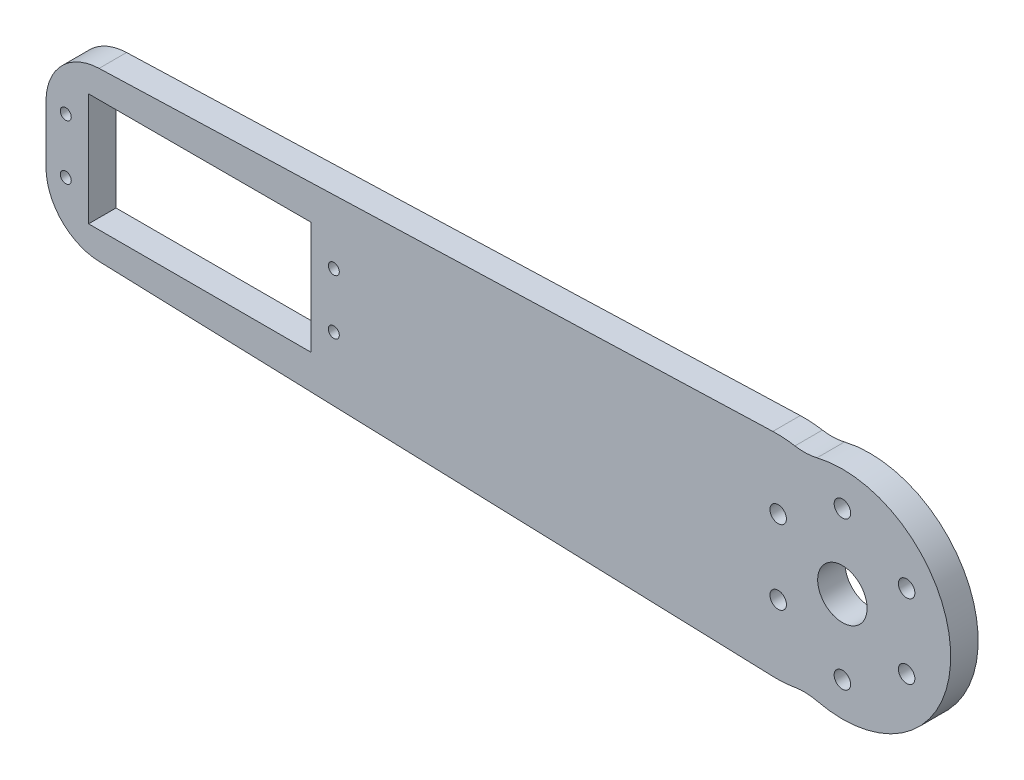
from build123d import *

# Parameters (mm, degrees)
SKETCH1_R           = 3
SKETCH1_W           = 40.5
SKETCH1_H           = 20.5
BOSS_EXTRUDE1_DEPTH = 5
FILLET2_R           = 20
BOSS_EXTRUDE2_START = -5
SKETCH3_R           = 19.722379498
SKETCH3_R_2         = 3
BOSS_EXTRUDE2_DEPTH = 5
FILLET3_R           = 10
SKETCH4_R           = 1
CUT_EXTRUDE1_DEPTH  = 6
SKETCH5_R           = 1.5
CUT_EXTRUDE2_DEPTH  = 6
SKETCH6_R           = 4.5
CUT_EXTRUDE3_DEPTH  = 6
CIRPATTERN1_COUNT   = 6


with BuildPart() as part:
    # Sketch1 → Boss-Extrude1 (new body)
    with BuildSketch(Plane.XY):
        Polygon((75, 20), (75, -20), (-75, -15), (-78, -15), (-78, 15), (-75, 15), align=None)
        with Locations((67, 0)):
            Circle(SKETCH1_R, mode=Mode.SUBTRACT)
        with Locations((-50, 0)):
            Rectangle(SKETCH1_W, SKETCH1_H, mode=Mode.SUBTRACT)
    extrude(amount=BOSS_EXTRUDE1_DEPTH)

    # Fillet2
    # the kernel refuses this fillet: 20 mm, written as the material it takes off along each edge
    with BuildSketch(Plane(origin=(75, -20, -51.694436733), x_dir=(0, 1, 0), z_dir=(0, 0, 1))) as fillet2_piece_1:
        with BuildLine():
            CenterArc((FILLET2_R * 1.03388873465, FILLET2_R), FILLET2_R, 178.090847567, 91.909152433)
            Line((FILLET2_R * 0.0344438276744, FILLET2_R * 1.03331483023), (0, 0))
            Line((0, 0), (FILLET2_R * 1.03388873465, 0))
        make_face()
    extrude(amount=108.388873465, mode=Mode.SUBTRACT)
    with BuildSketch(Plane(origin=(75, 20, -51.694436733), x_dir=(0, -1, 0), z_dir=(0, 0, 1))) as fillet2_piece_2:
        with BuildLine():
            CenterArc((FILLET2_R * 1.03388873465, -FILLET2_R), FILLET2_R, 90, 91.909152433)
            Line((FILLET2_R * 0.0344438276744, -FILLET2_R * 1.03331483023), (0, 0))
            Line((0, 0), (FILLET2_R * 1.03388873465, 0))
        make_face()
    extrude(amount=108.388873465, mode=Mode.SUBTRACT)

    # Sketch3 → Boss-Extrude2 (add)
    with BuildSketch(Plane.XY.offset(5).offset(BOSS_EXTRUDE2_START)):
        with Locations((67, 0)):
            Circle(SKETCH3_R)
        with Locations((67, 0)):
            Circle(SKETCH3_R_2, mode=Mode.SUBTRACT)
    extrude(amount=BOSS_EXTRUDE2_DEPTH)

    # Fillet3
    fillet3_edges = [part.edges().sort_by_distance(p)[0] for p in [
        (-78, 15, 2.5),
        (-78, -15, 2.5),
        (60.390814278, -18.582005197, 2.5),
        (60.390814278, 18.582005197, 2.5),
    ]]
    fillet(fillet3_edges, radius=FILLET3_R)

    # Sketch4 → Cut-Extrude1 (cut)
    with BuildSketch(Plane(origin=(0, 0, 0), x_dir=(-1, 0, 0), z_dir=(0, 0, -1))):
        with Locations((25.6, -5)):
            Circle(SKETCH4_R)
        with Locations(Location((25.6, 5, 0), (0, 0, 180))):
            Circle(SKETCH4_R)
        with Locations((74.4, 5)):
            Circle(SKETCH4_R)
        with Locations(Location((74.4, -5, 0), (0, 0, 180))):
            Circle(SKETCH4_R)
    extrude(amount=-CUT_EXTRUDE1_DEPTH, mode=Mode.SUBTRACT)

    # Sketch5 → Cut-Extrude2 (cut)
    with BuildSketch(Plane.XY.offset(5)):
        with Locations((67, 13.5)):
            Circle(SKETCH5_R)
    cut_extrude2 = extrude(amount=-CUT_EXTRUDE2_DEPTH, mode=Mode.SUBTRACT)

    # Sketch6 → Cut-Extrude3 (cut)
    with BuildSketch(Plane.XY.offset(5)):
        with Locations((67, 0)):
            Circle(SKETCH6_R)
    extrude(amount=-CUT_EXTRUDE3_DEPTH, mode=Mode.SUBTRACT)

    # CirPattern1: Cut-Extrude2 ×6 about axis
    cirpattern1_axis = Axis((67, 0, 0), (0, 0, 1))
    for i in range(1, CIRPATTERN1_COUNT):
        add(cut_extrude2.rotate(cirpattern1_axis, i * 360 / CIRPATTERN1_COUNT), mode=Mode.SUBTRACT)


solid = part.part
